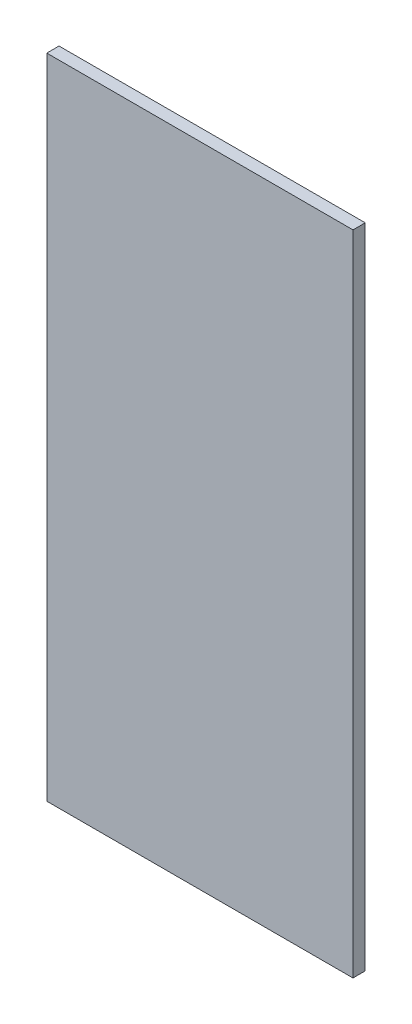
from build123d import *

# Parameters (mm, degrees)
SKETCH1_W           = 150
SKETCH1_H           = 317.37
BOSS_EXTRUDE1_DEPTH = 6


with BuildPart() as part:
    # Sketch1 → Boss-Extrude1 (new body)
    with BuildSketch(Plane.XY):
        Rectangle(SKETCH1_W, SKETCH1_H)
    extrude(amount=BOSS_EXTRUDE1_DEPTH)


solid = part.part
